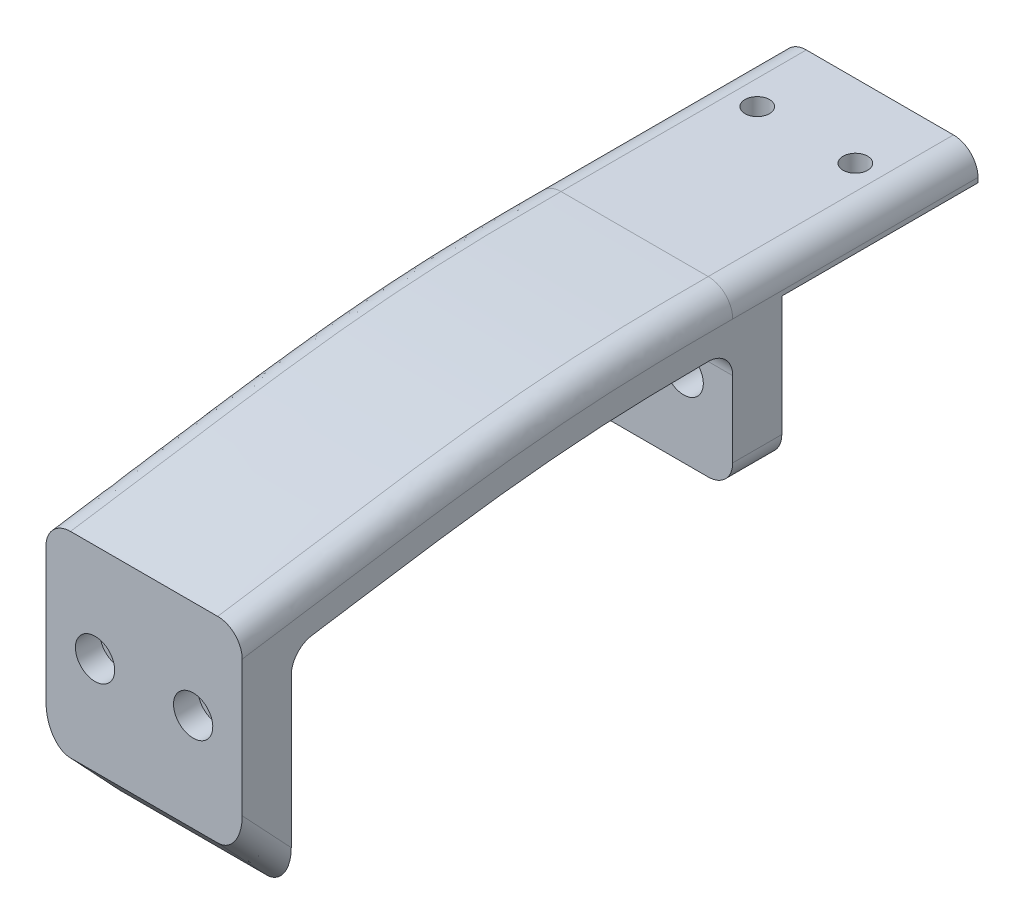
from build123d import *

# Parameters (mm, degrees)
SKETCH1_W           = 40
SKETCH1_H           = 120
BOSS_EXTRUDE1_DEPTH = 10
LOFT1_START         = -20
LOFT1_DEPTH         = 40
CUT_EXTRUDE2_DEPTH  = 109
FILLET2_R           = 5
SKETCH7_R           = 4
CUT_EXTRUDE3_DEPTH  = 5
SKETCH8_R           = 4
CUT_EXTRUDE4_DEPTH  = 10
FILLET4_R           = 5
BOSS_EXTRUDE3_DEPTH = 40
SKETCH10_R          = 2.5
CUT_EXTRUDE5_DEPTH  = 10


# Read off the part's stored shape, not the designer's step: Loft1
with BuildPart() as part:
    # Sketch1 → Boss-Extrude1 (new body)
    with BuildSketch(Plane.XY):
        Rectangle(SKETCH1_W, SKETCH1_H)
    extrude(amount=BOSS_EXTRUDE1_DEPTH)

    # Loft1 outline → Loft1 (add)
    with BuildSketch(Plane.YZ.offset(LOFT1_START)):
        with BuildLine():
            add(Edge.make_bspline(
                [(-60, 10), (-60, 30.441311123), (-60, 50.882622246), (-32, 70.441311123), (-11, 90.220655562), (10, 110)],
                knots=[0, 0, 0, 0, 0, 0, 1, 1, 1, 1, 1, 1], degree=5))
            Line((-60, 10), (60, 10))
            add(Edge.make_bspline(
                [(60, 10), (60, 30.009975124), (60, 50.019950248), (56, 70.009975124), (53, 90.004987562), (50, 110)],
                knots=[0, 0, 0, 0, 0, 0, 1, 1, 1, 1, 1, 1], degree=5))
            Line((50, 110), (10, 110))
        make_face()
    extrude(amount=LOFT1_DEPTH)

    # Sketch5 → Cut-Extrude2 (cut, symmetric)
    with BuildSketch(Plane(origin=(0, 0, 0), x_dir=(0, 0, -1), z_dir=(1, 0, 0))):
        with BuildLine():
            Line((0, -60), (-100, -60))
            Line((-100, -60), (-100, 41.393396846))
            add(Edge.make_bspline(
                [(-10, 50), (-14.168744818, 50), (-18.275601874, 49.996409138), (-26.428009759, 49.87077255), (-30.473567498, 49.749630948), (-38.552130932, 49.347381325), (-42.585186542, 49.066850503), (-50.67278015, 48.349847693), (-54.727313877, 47.913843652), (-62.876208691, 46.920588729), (-66.970526782, 46.363844017), (-75.202509115, 45.180338869), (-79.340154976, 44.554169827), (-87.648626866, 43.2832223), (-91.819473021, 42.639096286), (-97.329708937, 41.798417087), (-98.664929704, 41.595568065), (-100, 41.393396846)],
                knots=[0, 0, 0, 0, 0.125, 0.125, 0.25, 0.25, 0.375, 0.375, 0.5, 0.5, 0.625, 0.625, 0.75, 0.75, 0.875, 0.875, 0.914957714, 0.914957714, 0.914957714, 0.914957714], degree=3))
            Line((-10, 50), (-10, 24.6))
            Line((-10, 24.6), (0, 24.6))
            Line((0, 24.6), (0, -60))
        make_face()
    extrude(amount=CUT_EXTRUDE2_DEPTH, both=True, mode=Mode.SUBTRACT)

    # Fillet2
    fillet2_edges = [part.edges().sort_by_distance(p)[0] for p in [
        (20, 60, 5),
        (-20, 60, 5),
        (20, 4.6735266, 104.990679985),
        (-20, 4.6735266, 104.990679985),
        (-20, 57.319131326, 60.213292337),
        (20, 57.319131326, 60.213292337),
    ]]
    fillet(fillet2_edges, radius=FILLET2_R)

    # Sketch7 → Cut-Extrude3 (cut)
    with BuildSketch(Plane.XY.offset(110)):
        with Locations((-10, 30)):
            Circle(SKETCH7_R)
        with Locations(Location((10, 30, 0), (0, 0, 270))):
            Circle(SKETCH7_R)
        with Locations((10, -30)):
            Circle(SKETCH7_R)
        with Locations((-10, -30)):
            Circle(SKETCH7_R)
    extrude(amount=-CUT_EXTRUDE3_DEPTH, mode=Mode.SUBTRACT)

    # Sketch8 → Cut-Extrude4 (cut)
    with BuildSketch(Plane(origin=(0, 0, 0), x_dir=(-1, 0, 0), z_dir=(0, 0, -1))):
        with Locations((-10, 40.6)):
            Circle(SKETCH8_R)
        with Locations(Location((10, 40.6, 0), (0, 0, 180))):
            Circle(SKETCH8_R)
    extrude(amount=-CUT_EXTRUDE4_DEPTH, mode=Mode.SUBTRACT)

    # Fillet4
    fillet4_edges = [part.edges().sort_by_distance(p)[0] for p in [
        (-20, 24.6, 5),
        (20, 24.6, 5),
        (-10, 50, 10),
        (-10, 41.393396846, 100),
    ]]
    fillet(fillet4_edges, radius=FILLET4_R)

    # Sketch9 → Boss-Extrude3 (add)
    with BuildSketch(Plane(origin=(0, 0, 0), x_dir=(-1, 0, 0), z_dir=(0, 0, -1))):
        with BuildLine():
            Line((-20, 55), (-20, 54.045))
            Line((-20, 54.045), (20, 54.045))
            Line((20, 54.045), (20, 55))
            ThreePointArc((20, 55), (18.535533906, 58.535533906), (15, 60))
            Line((15, 60), (-15, 60))
            ThreePointArc((-15, 60), (-18.535533906, 58.535533906), (-20, 55))
        make_face()
    extrude(amount=BOSS_EXTRUDE3_DEPTH)

    # Sketch10 → Cut-Extrude5 (cut)
    with BuildSketch(Plane(origin=(0, 60, 0), x_dir=(1, 0, 0), z_dir=(0, 1, 0))):
        with Locations(Location((-10, 25, 0), (0, 0, 270))):
            Circle(SKETCH10_R)
        with Locations(Location((10, 25, 0), (0, 0, 270))):
            Circle(SKETCH10_R)
    extrude(amount=-CUT_EXTRUDE5_DEPTH, mode=Mode.SUBTRACT)


solid = part.part
